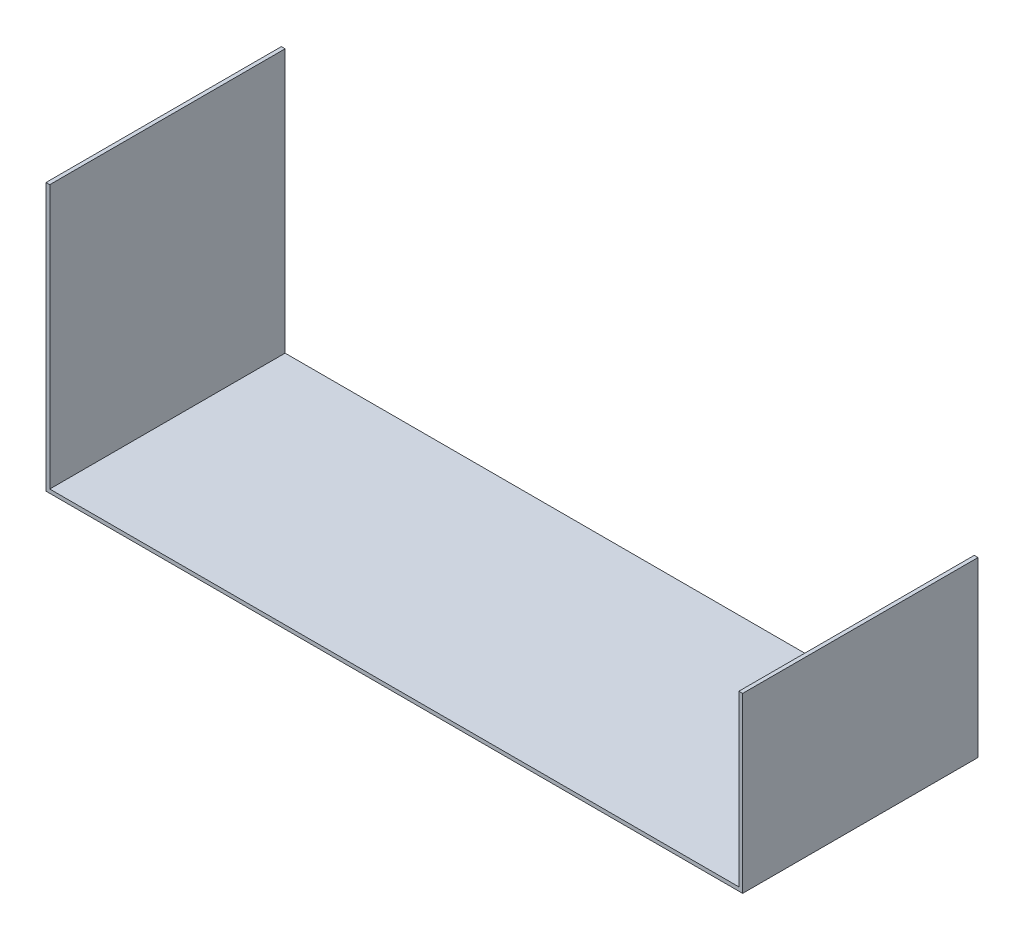
from build123d import *

# Parameters (mm, degrees)
EXTRUDE_1_DEPTH = 125


with BuildPart() as part:
    # 草图1 → 凸台-拉伸1 (new body)
    with BuildSketch(Plane.XY):
        Polygon((0, 0), (370, 0), (370, 92), (368, 92), (368, 2), (2, 2), (2, 142), (0, 142), align=None)
    extrude(amount=EXTRUDE_1_DEPTH)


solid = part.part
